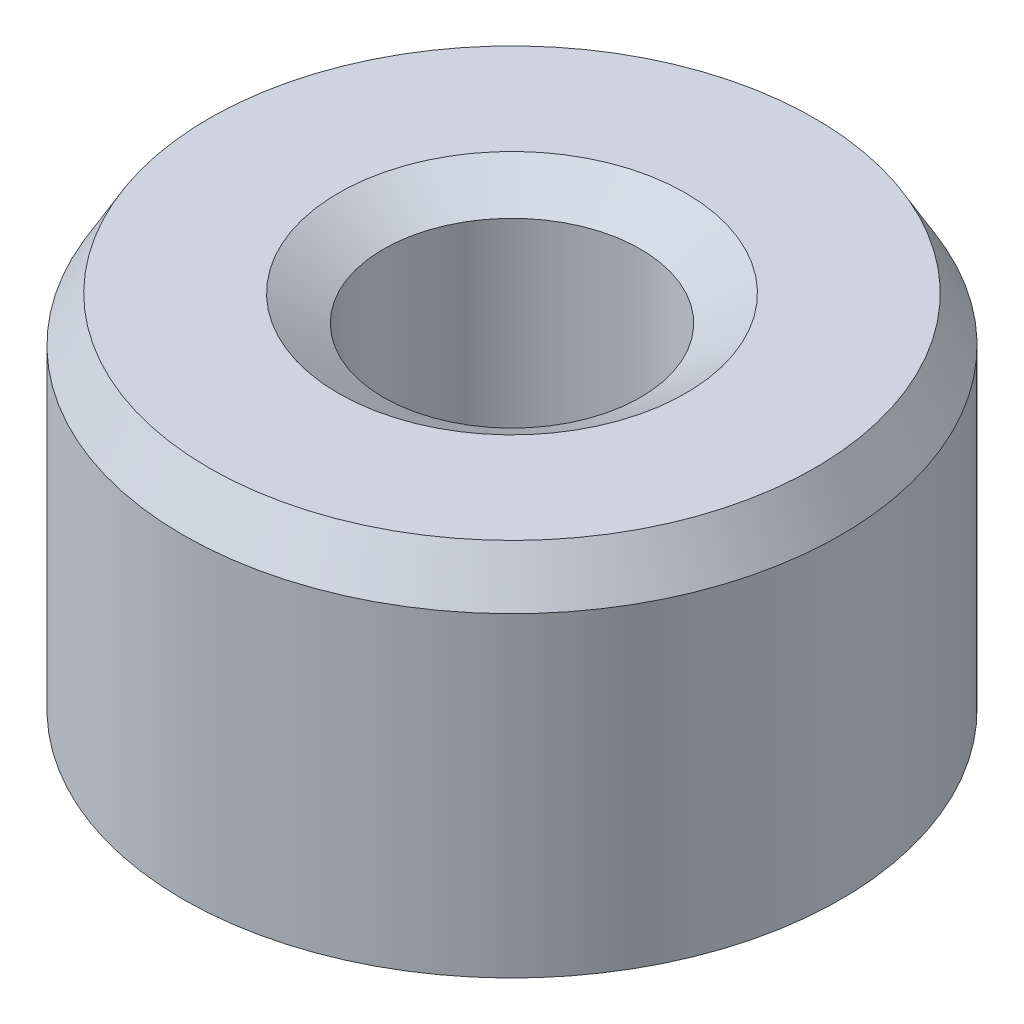
from build123d import *
from OCP.BRepFilletAPI import BRepFilletAPI_MakeChamfer

# Parameters (mm, degrees)
SKETCH1_R           = 27.5
BOSS_EXTRUDE1_DEPTH = 32.326275413
SKETCH2_R           = 10.746116523
CUT_EXTRUDE1_DEPTH  = 51.571613402
CHAMFER1_SIZE       = 3.768384729
CHAMFER1_SIZE2      = 2.175677938


with BuildPart() as part:
    # Sketch1 → Boss-Extrude1 (new body)
    with BuildSketch(Plane(origin=(0, 0, 0), x_dir=(1, 0, 0), z_dir=(0, 1, 0))):
        Circle(SKETCH1_R)
    extrude(amount=BOSS_EXTRUDE1_DEPTH)

    # Sketch2 → Cut-Extrude1 (cut, through all)
    with BuildSketch(Plane(origin=(0, 0, 0), x_dir=(1, 0, 0), z_dir=(0, 1, 0))):
        Circle(SKETCH2_R)
    extrude(amount=CUT_EXTRUDE1_DEPTH, mode=Mode.SUBTRACT)

    # Chamfer1: one chamfer whose edges measure the first distance from different faces: ONE call of the kernel's chamfer builder (chamfer() names one face for all edges)
    chamfer1_edges_1 = [part.edges().sort_by_distance(p)[0] for p in [
        (-10.746116523, 32.326275413, 0),
    ]]
    chamfer1_side_1 = [part.faces().sort_by_distance(p)[0] for p in [
        (-26.722182541, 32.326275413, 0),
    ]]
    chamfer1_edges_2 = [part.edges().sort_by_distance(p)[0] for p in [
        (-10.746116523, 0, 0),
    ]]
    chamfer1_side_2 = [part.faces().sort_by_distance(p)[0] for p in [
        (-10.746116523, 16.163137707, 0),
    ]]
    chamfer1_edges_3 = [part.edges().sort_by_distance(p)[0] for p in [
        (-27.5, 0, 0),
    ]]
    chamfer1_side_3 = [part.faces().sort_by_distance(p)[0] for p in [
        (-26.722182541, 0, 0),
    ]]
    chamfer1_edges_4 = [part.edges().sort_by_distance(p)[0] for p in [
        (-27.5, 32.326275413, 0),
    ]]
    chamfer1_side_4 = [part.faces().sort_by_distance(p)[0] for p in [
        (-27.5, 16.163137707, 0),
    ]]
    chamfer1 = BRepFilletAPI_MakeChamfer(part.part.solid().wrapped)
    for e in chamfer1_edges_1:
        chamfer1.Add(CHAMFER1_SIZE, CHAMFER1_SIZE2, e.wrapped, chamfer1_side_1[0].wrapped)  # the first distance lies on this face
    for e in chamfer1_edges_2:
        chamfer1.Add(CHAMFER1_SIZE, CHAMFER1_SIZE2, e.wrapped, chamfer1_side_2[0].wrapped)  # the first distance lies on this face
    for e in chamfer1_edges_3:
        chamfer1.Add(CHAMFER1_SIZE, CHAMFER1_SIZE2, e.wrapped, chamfer1_side_3[0].wrapped)  # the first distance lies on this face
    for e in chamfer1_edges_4:
        chamfer1.Add(CHAMFER1_SIZE, CHAMFER1_SIZE2, e.wrapped, chamfer1_side_4[0].wrapped)  # the first distance lies on this face
    add(Compound.cast(chamfer1.Shape()), mode=Mode.REPLACE)


solid = part.part
